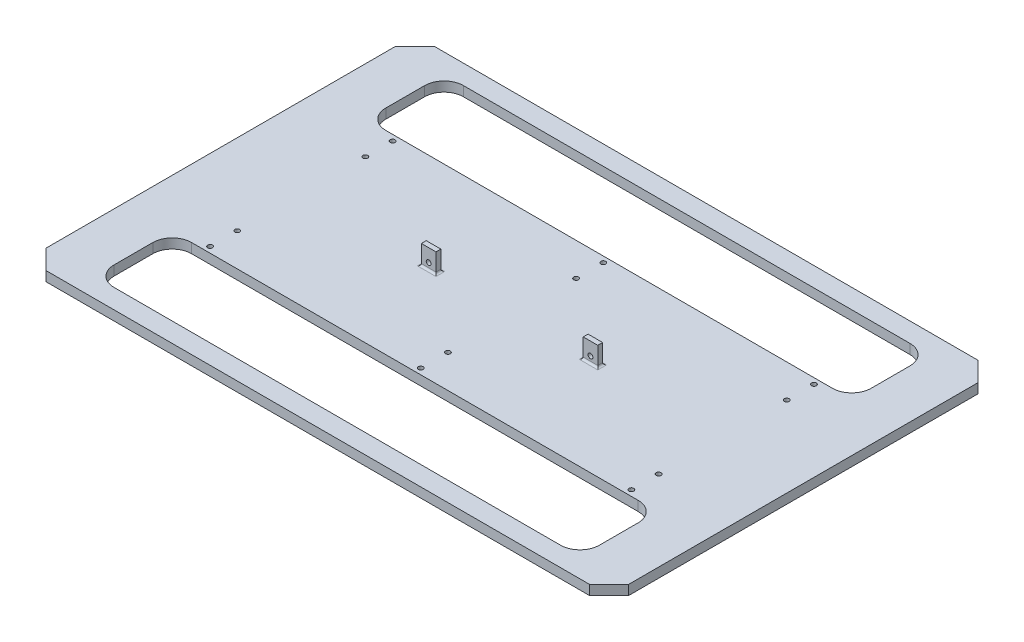
from build123d import *

# Parameters (mm, degrees)
BOSS_EXTRUDE1_DEPTH           = 5
CUT_EXTRUDE1_DEPTH            = 361.589794642
CUT_EXTRUDE1_DEPTH_BACK       = 361.589794642
SKETCH3_W                     = 7.5
SKETCH3_H                     = 5
BOSS_EXTRUDE2_DEPTH           = 20
F_5_0MM_START                 = -2.5
F_5_0MM_DOWEL_HOLE1_OUTLINE_R = 2.5
F_5_0MM_DOWEL_HOLE1_DEPTH     = 5
FILLET1_R                     = 2
F_5_0MM_DOWEL_HOLE3_D         = 5


# Read off the part's stored shape, not the designer's step: Ø5.0mm Dowel Hole1
with BuildPart() as part:
    # Sketch1 → Boss-Extrude1 (new, symmetric)
    with BuildSketch(Plane(origin=(0, 0, 0), x_dir=(1, 0, 0), z_dir=(0, 1, 0))):
        Polygon((-300, 180), (-280, 200), (280, 200), (300, 180), (300, -180), (280, -200), (-280, -200), (-300, -180), align=None)
    extrude(amount=BOSS_EXTRUDE1_DEPTH, both=True)

    # Sketch2 → Cut-Extrude1 (cut, two sides: drawn at the far end of the back side and taken through both)
    with BuildSketch(Plane(origin=(0, 0, 0), x_dir=(1, 0, 0), z_dir=(0, 1, 0)).offset(-CUT_EXTRUDE1_DEPTH_BACK)):
        with BuildLine():
            Line((-230, 180), (230, 180))
            ThreePointArc((230, 180), (244.142135624, 174.142135624), (250, 160))
            Line((250, 160), (250, 120))
            ThreePointArc((250, 120), (244.142135624, 105.857864376), (230, 100))
            Line((230, 100), (-230, 100))
            ThreePointArc((-230, 100), (-244.142135624, 105.857864376), (-250, 120))
            Line((-250, 120), (-250, 160))
            ThreePointArc((-250, 160), (-244.142135624, 174.142135624), (-230, 180))
        make_face()
        with BuildLine():
            Line((250, -160), (250, -120))
            ThreePointArc((250, -120), (244.142135624, -105.857864376), (230, -100))
            Line((230, -100), (-230, -100))
            ThreePointArc((-230, -100), (-244.142135624, -105.857864376), (-250, -120))
            Line((-250, -120), (-250, -160))
            ThreePointArc((-250, -160), (-244.142135624, -174.142135624), (-230, -180))
            Line((-230, -180), (230, -180))
            ThreePointArc((230, -180), (244.142135624, -174.142135624), (250, -160))
        make_face()
    extrude(amount=CUT_EXTRUDE1_DEPTH + CUT_EXTRUDE1_DEPTH_BACK, mode=Mode.SUBTRACT)

    # Sketch3 → Boss-Extrude2 (add)
    with BuildSketch(Plane(origin=(0, 5, 0), x_dir=(1, 0, 0), z_dir=(0, 1, 0))):
        with Locations((-87.083333333, 0)):
            Rectangle(SKETCH3_W, SKETCH3_H)
        with Locations((-79.583333333, 0)):
            Rectangle(SKETCH3_W, SKETCH3_H)
        with Locations((79.583333333, 0)):
            Rectangle(SKETCH3_W, SKETCH3_H)
        with Locations((87.083333333, 0)):
            Rectangle(SKETCH3_W, SKETCH3_H)
    extrude(amount=BOSS_EXTRUDE2_DEPTH)

    # Ø5.0mm Dowel Hole1 outline → Ø5.0mm Dowel Hole1 (cut)
    with BuildSketch(Plane.XY.offset(F_5_0MM_START)):
        with Locations((83.333333333, 11.67)):
            Circle(F_5_0MM_DOWEL_HOLE1_OUTLINE_R)
        with Locations((-83.333333333, 11.67)):
            Circle(F_5_0MM_DOWEL_HOLE1_OUTLINE_R)
    extrude(amount=F_5_0MM_DOWEL_HOLE1_DEPTH, mode=Mode.SUBTRACT)

    # Fillet1
    fillet1_edges = [part.edges().sort_by_distance(p)[0] for p in [
        (-90.833333333, 5, 0),
        (-83.333333333, 5, 2.5),
        (-83.333333333, 5, -2.5),
        (-75.833333333, 5, 0),
        (75.833333333, 5, 0),
        (83.333333333, 5, 2.5),
        (83.333333333, 5, -2.5),
        (90.833333333, 5, 0),
    ]]
    fillet(fillet1_edges, radius=FILLET1_R)

    # Ø5.0mm Dowel Hole3 (through all)
    with Locations(Plane(origin=(0, 5, 0), x_dir=(1, 0, 0), z_dir=(0, 1, 0))):
        with Locations((-217, 94), (-217, 66), (-217, -94), (-217, -66), (0, 94), (0, 66), (0, -66), (0, -94), (217, -94), (217, -66), (217, 66), (217, 94)):
            Hole(F_5_0MM_DOWEL_HOLE3_D / 2)


solid = part.part
